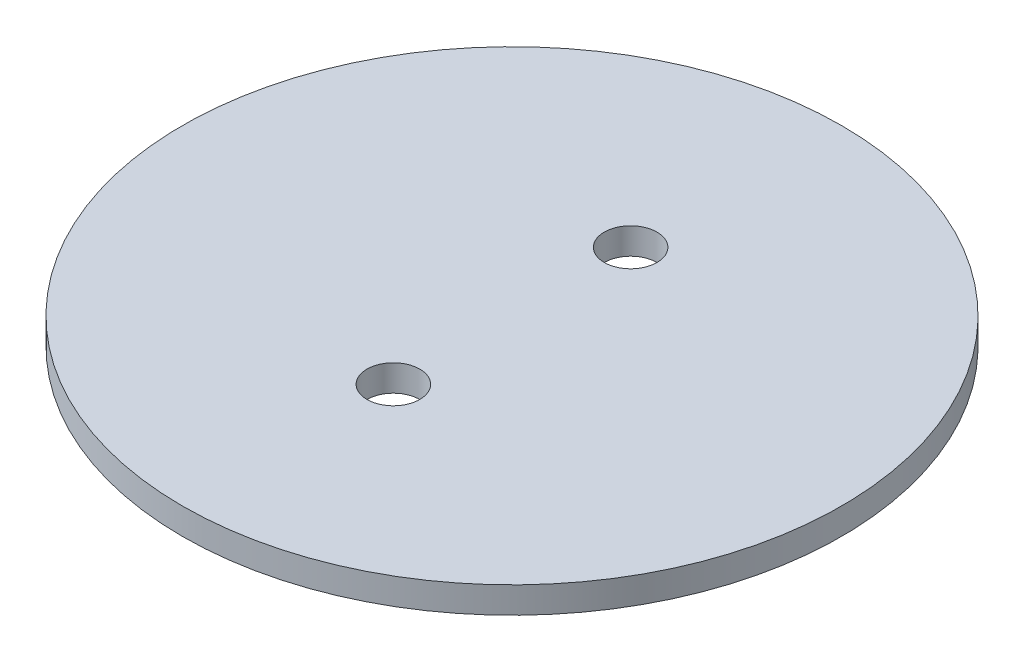
from build123d import *

# Parameters (mm, degrees)
SKETCH1_R           = 37.5
BOSS_EXTRUDE1_DEPTH = 3


with BuildPart() as part:
    # Sketch1 → Boss-Extrude1 (new body)
    with BuildSketch(Plane(origin=(0, 0, 0), x_dir=(1, 0, 0), z_dir=(0, 1, 0))):
        Circle(SKETCH1_R)
        with BuildLine():
            ThreePointArc((3, -13.5), (-2.121320344, -15.621320344), (0, -10.5))
            ThreePointArc((0, -10.5), (2.121320344, -11.378679656), (3, -13.5))
        make_face(mode=Mode.SUBTRACT)
        with BuildLine():
            ThreePointArc((3, 13.5), (2.121320344, 11.378679656), (0, 10.5))
            ThreePointArc((0, 10.5), (-2.121320344, 15.621320344), (3, 13.5))
        make_face(mode=Mode.SUBTRACT)
    extrude(amount=-BOSS_EXTRUDE1_DEPTH)


solid = part.part
